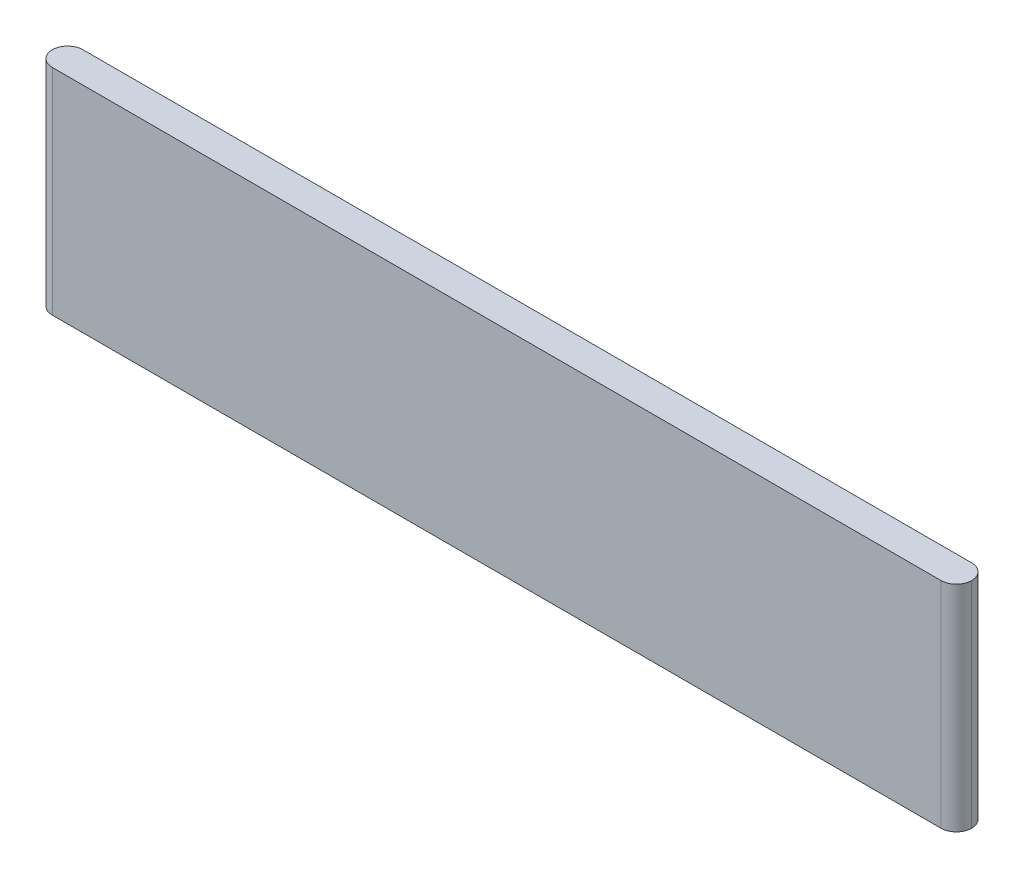
from build123d import *

# Parameters (mm, degrees)
SKETCH1_W             = 1500
SKETCH1_H             = 350
BOSS_EXTRUDE1_DEPTH   = 50
FILLET1_R             = 25
BODY_MOVE_COPY1_ANGLE = 90


with BuildPart() as part:
    # Sketch1 → Boss-Extrude1 (new body)
    with BuildSketch(Plane(origin=(0, 0, 0), x_dir=(1, 0, 0), z_dir=(0, 1, 0))):
        Rectangle(SKETCH1_W, SKETCH1_H)
    extrude(amount=BOSS_EXTRUDE1_DEPTH)

    # Fillet1
    fillet1_edges = [part.edges().sort_by_distance(p)[0] for p in [
        (750, 0, 0),
        (750, 50, 0),
        (-750, 0, 0),
        (-750, 50, 0),
    ]]
    fillet(fillet1_edges, radius=FILLET1_R - 0.0001)  # a hair under: the kernel refuses the full size


with BuildPart() as part_1:
    # Body-Move/Copy1: moved
    add(part.part.rotate(Axis((0, 0, 0), (1, 0, 0)), BODY_MOVE_COPY1_ANGLE))


solid = part_1.part
